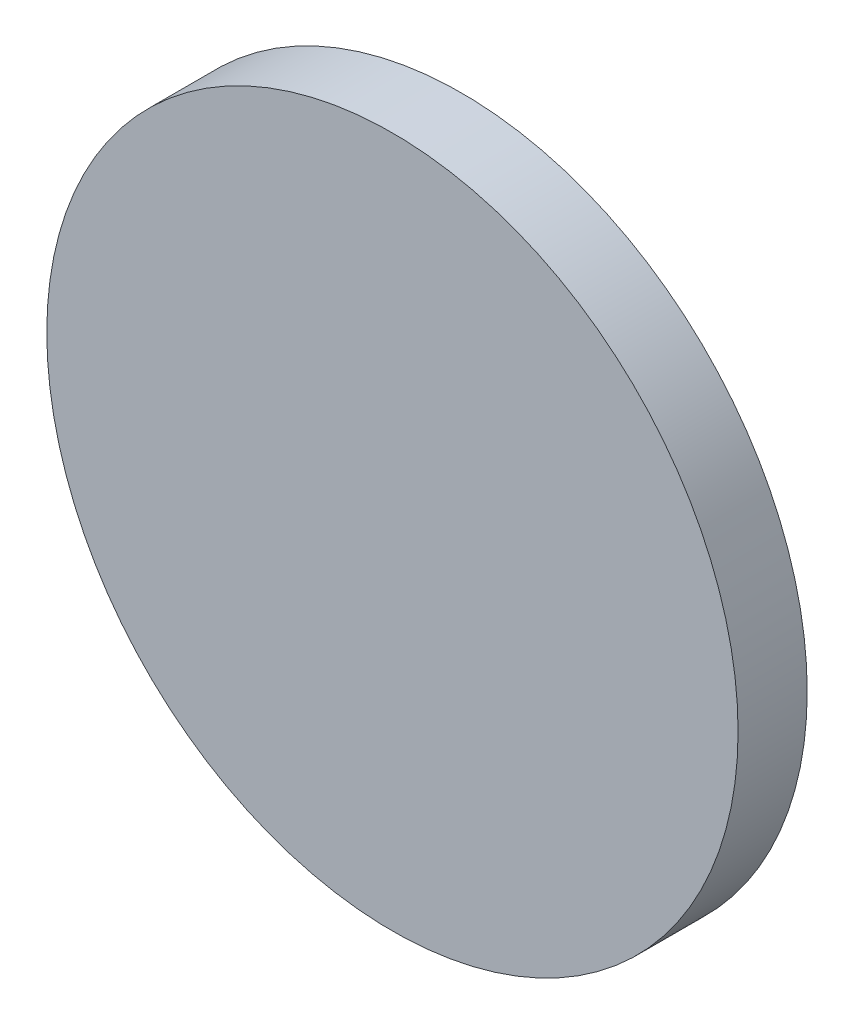
from build123d import *

# Parameters (mm, degrees)
SKIZZE2_R                       = 4.5
AUFSATZ_LINEAR_AUSTRAGEN1_DEPTH = 0.9


with BuildPart() as part:
    # Skizze2 → Aufsatz-Linear austragen1 (new body)
    with BuildSketch(Plane.XY):
        Circle(SKIZZE2_R)
    extrude(amount=AUFSATZ_LINEAR_AUSTRAGEN1_DEPTH)


solid = part.part
